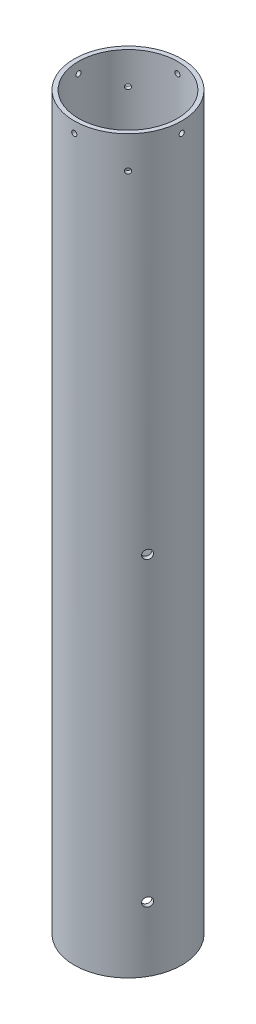
from build123d import *

# Parameters (mm, degrees)
SKETCH_1_R               = 25
SKETCH_1_R_2             = 23
EXTRUDE_1_DEPTH          = 340
SKETCH_2_R               = 1.2
CUT_EXTRUDE_1_DEPTH      = 342.833292703
PATTERN_CIRCULAR_1_COUNT = 4
SKETCH_3_R               = 1.2
CUT_EXTRUDE_2_DEPTH      = 342.833292817
PATTERN_CIRCULAR_2_COUNT = 4
SKETCH_9_R               = 2.05
CUT_EXTRUDE_6_DEPTH      = 95
PATTERN_CIRCULAR_3_COUNT = 3


with BuildPart() as part:
    # Эскиз1 → Бобышка-Вытянуть1 (new body)
    with BuildSketch(Plane(origin=(0, 0, 0), x_dir=(1, 0, 0), z_dir=(0, 1, 0))):
        Circle(SKETCH_1_R)
        Circle(SKETCH_1_R_2, mode=Mode.SUBTRACT)
    extrude(amount=EXTRUDE_1_DEPTH)

    # Эскиз2 → Вырез-Вытянуть1 (cut, through all)
    with BuildSketch(Plane(origin=(0, 0, 0), x_dir=(0, 0, -1), z_dir=(1, 0, 0))):
        with Locations((0, 335)):
            Circle(SKETCH_2_R)
    cut_extrude_1 = extrude(amount=-CUT_EXTRUDE_1_DEPTH, mode=Mode.SUBTRACT)

    # Круговой массив1: Вырез-Вытянуть1 ×4 about axis
    pattern_circular_1_axis = Axis((0, 340, 0), (0, -1, 0))
    for i in range(1, PATTERN_CIRCULAR_1_COUNT):
        add(cut_extrude_1.rotate(pattern_circular_1_axis, i * 360 / PATTERN_CIRCULAR_1_COUNT), mode=Mode.SUBTRACT)

    # Эскиз3 → Вырез-Вытянуть2 (cut, through all)
    with BuildSketch(Plane(origin=(0, 0, 0), x_dir=(0, -1, 0), z_dir=(-0.7071067811865488, 0, 0.7071067811865464))):
        with Locations((-325, 0)):
            Circle(SKETCH_3_R)
    cut_extrude_2 = extrude(amount=-CUT_EXTRUDE_2_DEPTH, mode=Mode.SUBTRACT)

    # Круговой массив2: Вырез-Вытянуть2 ×4 about axis
    pattern_circular_2_axis = Axis((0, 340, 0), (0, -1, 0))
    for i in range(1, PATTERN_CIRCULAR_2_COUNT):
        add(cut_extrude_2.rotate(pattern_circular_2_axis, i * 360 / PATTERN_CIRCULAR_2_COUNT), mode=Mode.SUBTRACT)

    # Эскиз9 → Вырез-Вытянуть6 (cut)
    with BuildSketch(Plane.XY):
        with Locations((0, 30)):
            Circle(SKETCH_9_R)
        with Locations((0, 170)):
            Circle(SKETCH_9_R)
    cut_extrude_6 = extrude(amount=-CUT_EXTRUDE_6_DEPTH, mode=Mode.SUBTRACT)

    # Круговой массив3: Вырез-Вытянуть6 ×3 about axis
    pattern_circular_3_axis = Axis((0, 340, 0), (0, -1, 0))
    for i in range(1, PATTERN_CIRCULAR_3_COUNT):
        add(cut_extrude_6.rotate(pattern_circular_3_axis, i * 360 / PATTERN_CIRCULAR_3_COUNT), mode=Mode.SUBTRACT)


solid = part.part
